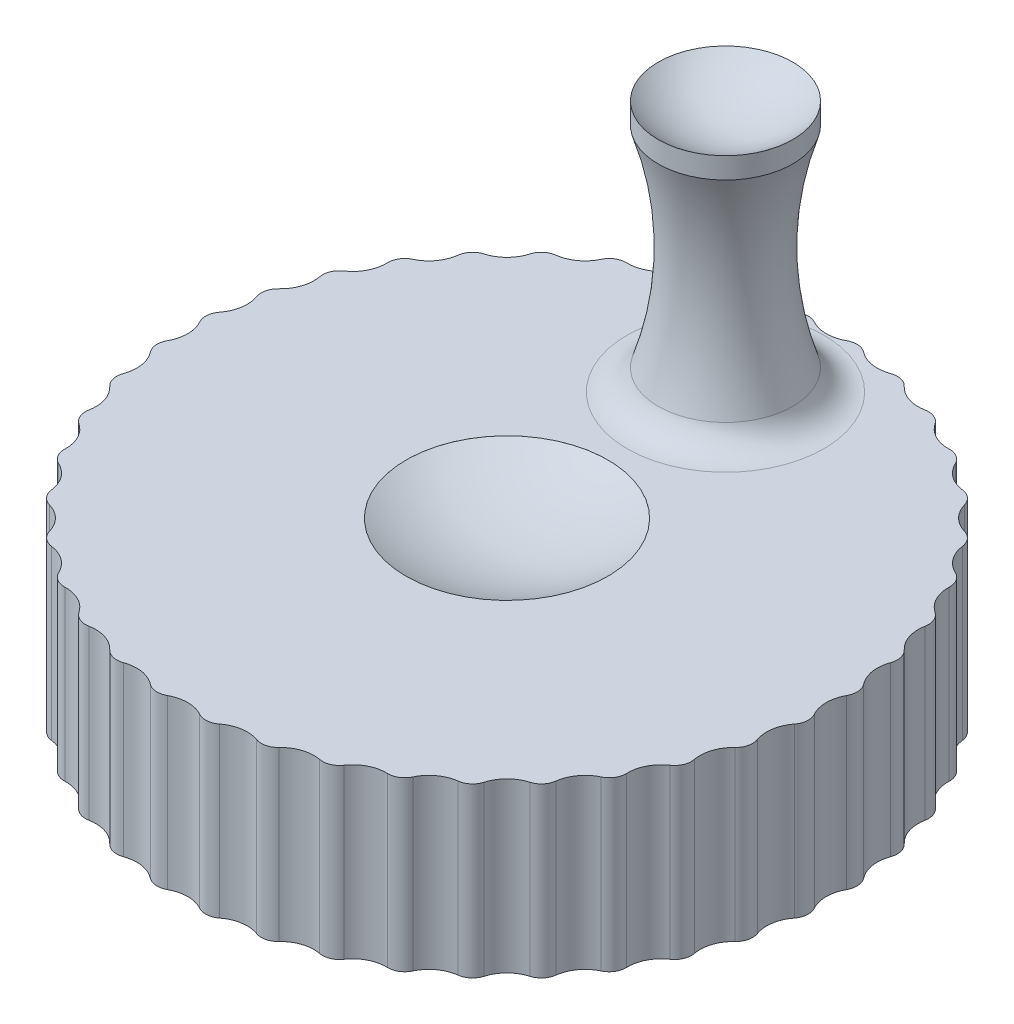
from build123d import *

# Parameters (mm, degrees)
SKETCH1_R               = 20
BOSS_EXTRUDE1_DEPTH     = 10
CUT_EXTRUDE1_DEPTH      = 31
CUT_EXTRUDE1_DEPTH_BACK = 31
FILLET2_R               = 1
SKETCH4_R               = 6
CUT_EXTRUDE3_DEPTH      = 0.001
DOME2_FACE_RADIUS       = 6
DOME2_HEIGHT            = 1.5
SKETCH5_R               = 4
BOSS_EXTRUDE2_DEPTH     = 15
FILLET3_R               = 2
DOME3_FACE_RADIUS       = 4
DOME3_HEIGHT            = 1.5
SKETCH9_R               = 2.75
CUT_EXTRUDE4_DEPTH      = 7.5
CHAMFER1_SIZE           = 2
CHAMFER1_SIZE2          = 0.727940469


with BuildPart() as part:
    # Sketch1 → Boss-Extrude1 (new body)
    with BuildSketch(Plane(origin=(0, 0, 0), x_dir=(1, 0, 0), z_dir=(0, 1, 0))):
        with Locations(Location((0, 0, 0), (0, 0, 270))):
            Circle(SKETCH1_R)
    extrude(amount=BOSS_EXTRUDE1_DEPTH)

    # Sketch2 → Cut-Extrude1 (cut, two sides: drawn at the far end of the back side and taken through both)
    with BuildSketch(Plane(origin=(0, 10, 0), x_dir=(1, 0, 0), z_dir=(0, 1, 0)).offset(-CUT_EXTRUDE1_DEPTH_BACK)):
        with BuildLine():
            ThreePointArc((11.531002805, -18.816886382), (13.519060803, -18.607390871), (14.332646581, -16.781373031))
            ThreePointArc((14.332646581, -16.781373031), (16.263455967, -16.263455967), (16.781373031, -14.332646581))
            ThreePointArc((16.781373031, -14.332646581), (18.607390871, -13.519060803), (18.816886382, -11.531002805))
            ThreePointArc((18.816886382, -11.531002805), (20.493150056, -10.441781494), (20.389065541, -8.445427471))
            ThreePointArc((20.389065541, -8.445427471), (21.874299875, -7.107390871), (21.459198239, -5.151897684))
            ThreePointArc((21.459198239, -5.151897684), (22.716831834, -3.597992696), (22.000934257, -1.731511078))
            ThreePointArc((22.000934257, -1.731511078), (23, 0), (22.000934257, 1.731511078))
            ThreePointArc((22.000934257, 1.731511078), (22.716831834, 3.597992696), (21.459198239, 5.151897684))
            ThreePointArc((21.459198239, 5.151897684), (21.874299875, 7.107390871), (20.389065541, 8.445427471))
            ThreePointArc((20.389065541, 8.445427471), (20.493150056, 10.441781494), (18.816886382, 11.531002805))
            ThreePointArc((18.816886382, 11.531002805), (18.607390871, 13.519060803), (16.781373031, 14.332646581))
            ThreePointArc((16.781373031, 14.332646581), (16.263455967, 16.263455967), (14.332646581, 16.781373031))
            ThreePointArc((14.332646581, 16.781373031), (13.519060803, 18.607390871), (11.531002805, 18.816886382))
            ThreePointArc((11.531002805, 18.816886382), (10.441781494, 20.493150056), (8.445427471, 20.389065541))
            ThreePointArc((8.445427471, 20.389065541), (7.107390871, 21.874299875), (5.151897684, 21.459198239))
            ThreePointArc((5.151897684, 21.459198239), (3.597992696, 22.716831834), (1.731511078, 22.000934257))
            ThreePointArc((1.731511078, 22.000934257), (0, 23), (-1.731511078, 22.000934257))
            ThreePointArc((-1.731511078, 22.000934257), (-3.597992696, 22.716831834), (-5.151897684, 21.459198239))
            ThreePointArc((-5.151897684, 21.459198239), (-7.107390871, 21.874299875), (-8.445427471, 20.389065541))
            ThreePointArc((-8.445427471, 20.389065541), (-10.441781494, 20.493150056), (-11.531002805, 18.816886382))
            ThreePointArc((-11.531002805, 18.816886382), (-13.519060803, 18.607390871), (-14.332646581, 16.781373031))
            ThreePointArc((-14.332646581, 16.781373031), (-16.263455967, 16.263455967), (-16.781373031, 14.332646581))
            ThreePointArc((-16.781373031, 14.332646581), (-18.607390871, 13.519060803), (-18.816886382, 11.531002805))
            ThreePointArc((-18.816886382, 11.531002805), (-20.493150056, 10.441781494), (-20.389065541, 8.445427471))
            ThreePointArc((-20.389065541, 8.445427471), (-21.874299875, 7.107390871), (-21.459198239, 5.151897684))
            ThreePointArc((-21.459198239, 5.151897684), (-22.716831834, 3.597992696), (-22.000934257, 1.731511078))
            ThreePointArc((-22.000934257, 1.731511078), (-23, 0), (-22.000934257, -1.731511078))
            ThreePointArc((-22.000934257, -1.731511078), (-22.716831834, -3.597992696), (-21.459198239, -5.151897684))
            ThreePointArc((-21.459198239, -5.151897684), (-21.874299875, -7.107390871), (-20.389065541, -8.445427471))
            ThreePointArc((-20.389065541, -8.445427471), (-20.493150056, -10.441781494), (-18.816886382, -11.531002805))
            ThreePointArc((-18.816886382, -11.531002805), (-18.607390871, -13.519060803), (-16.781373031, -14.332646581))
            ThreePointArc((-16.781373031, -14.332646581), (-16.263455967, -16.263455967), (-14.332646581, -16.781373031))
            ThreePointArc((-14.332646581, -16.781373031), (-13.519060803, -18.607390871), (-11.531002805, -18.816886382))
            ThreePointArc((-11.531002805, -18.816886382), (-10.441781494, -20.493150056), (-8.445427471, -20.389065541))
            ThreePointArc((-8.445427471, -20.389065541), (-7.107390871, -21.874299875), (-5.151897684, -21.459198239))
            ThreePointArc((-5.151897684, -21.459198239), (-3.597992696, -22.716831834), (-1.731511078, -22.000934257))
            ThreePointArc((-1.731511078, -22.000934257), (0, -23), (1.731511078, -22.000934257))
            ThreePointArc((1.731511078, -22.000934257), (3.597992696, -22.716831834), (5.151897684, -21.459198239))
            ThreePointArc((5.151897684, -21.459198239), (7.107390871, -21.874299875), (8.445427471, -20.389065541))
            ThreePointArc((8.445427471, -20.389065541), (10.441781494, -20.493150056), (11.531002805, -18.816886382))
        make_face()
        with BuildLine():
            ThreePointArc((-1.553612688, 19.740520895), (0, 19), (1.553612688, 19.740520895))
            ThreePointArc((1.553612688, 19.740520895), (2.972254836, 18.766078471), (4.622582964, 19.254443756))
            ThreePointArc((4.622582964, 19.254443756), (5.871322893, 18.07007381), (7.577729905, 18.294258309))
            ThreePointArc((7.577729905, 18.294258309), (8.625819495, 16.92912396), (10.346287987, 16.883607508))
            ThreePointArc((10.346287987, 16.883607508), (11.167919794, 15.371322893), (12.860086122, 15.057226256))
            ThreePointArc((12.860086122, 15.057226256), (13.435028843, 13.435028843), (15.057226256, 12.860086122))
            ThreePointArc((15.057226256, 12.860086122), (15.371322893, 11.167919794), (16.883607508, 10.346287987))
            ThreePointArc((16.883607508, 10.346287987), (16.92912396, 8.625819495), (18.294258309, 7.577729905))
            ThreePointArc((18.294258309, 7.577729905), (18.07007381, 5.871322893), (19.254443756, 4.622582964))
            ThreePointArc((19.254443756, 4.622582964), (18.766078471, 2.972254836), (19.740520895, 1.553612688))
            ThreePointArc((19.740520895, 1.553612688), (19, 0), (19.740520895, -1.553612688))
            ThreePointArc((19.740520895, -1.553612688), (18.766078471, -2.972254836), (19.254443756, -4.622582964))
            ThreePointArc((19.254443756, -4.622582964), (18.07007381, -5.871322893), (18.294258309, -7.577729905))
            ThreePointArc((18.294258309, -7.577729905), (16.92912396, -8.625819495), (16.883607508, -10.346287987))
            ThreePointArc((16.883607508, -10.346287987), (15.371322893, -11.167919794), (15.057226256, -12.860086122))
            ThreePointArc((15.057226256, -12.860086122), (13.435028843, -13.435028843), (12.860086122, -15.057226256))
            ThreePointArc((12.860086122, -15.057226256), (11.167919794, -15.371322893), (10.346287987, -16.883607508))
            ThreePointArc((10.346287987, -16.883607508), (8.625819495, -16.92912396), (7.577729905, -18.294258309))
            ThreePointArc((7.577729905, -18.294258309), (5.871322893, -18.07007381), (4.622582964, -19.254443756))
            ThreePointArc((4.622582964, -19.254443756), (2.972254836, -18.766078471), (1.553612688, -19.740520895))
            ThreePointArc((1.553612688, -19.740520895), (0, -19), (-1.553612688, -19.740520895))
            ThreePointArc((-1.553612688, -19.740520895), (-2.972254836, -18.766078471), (-4.622582964, -19.254443756))
            ThreePointArc((-4.622582964, -19.254443756), (-5.871322893, -18.07007381), (-7.577729905, -18.294258309))
            ThreePointArc((-7.577729905, -18.294258309), (-8.625819495, -16.92912396), (-10.346287987, -16.883607508))
            ThreePointArc((-10.346287987, -16.883607508), (-11.167919794, -15.371322893), (-12.860086122, -15.057226256))
            ThreePointArc((-12.860086122, -15.057226256), (-13.435028843, -13.435028843), (-15.057226256, -12.860086122))
            ThreePointArc((-15.057226256, -12.860086122), (-15.371322893, -11.167919794), (-16.883607508, -10.346287987))
            ThreePointArc((-16.883607508, -10.346287987), (-16.92912396, -8.625819495), (-18.294258309, -7.577729905))
            ThreePointArc((-18.294258309, -7.577729905), (-18.07007381, -5.871322893), (-19.254443756, -4.622582964))
            ThreePointArc((-19.254443756, -4.622582964), (-18.766078471, -2.972254836), (-19.740520895, -1.553612688))
            ThreePointArc((-19.740520895, -1.553612688), (-19, 0), (-19.740520895, 1.553612688))
            ThreePointArc((-19.740520895, 1.553612688), (-18.766078471, 2.972254836), (-19.254443756, 4.622582964))
            ThreePointArc((-19.254443756, 4.622582964), (-18.07007381, 5.871322893), (-18.294258309, 7.577729905))
            ThreePointArc((-18.294258309, 7.577729905), (-16.92912396, 8.625819495), (-16.883607508, 10.346287987))
            ThreePointArc((-16.883607508, 10.346287987), (-15.371322893, 11.167919794), (-15.057226256, 12.860086122))
            ThreePointArc((-15.057226256, 12.860086122), (-13.435028843, 13.435028843), (-12.860086122, 15.057226256))
            ThreePointArc((-12.860086122, 15.057226256), (-11.167919794, 15.371322893), (-10.346287987, 16.883607508))
            ThreePointArc((-10.346287987, 16.883607508), (-8.625819495, 16.92912396), (-7.577729905, 18.294258309))
            ThreePointArc((-7.577729905, 18.294258309), (-5.871322893, 18.07007381), (-4.622582964, 19.254443756))
            ThreePointArc((-4.622582964, 19.254443756), (-2.972254836, 18.766078471), (-1.553612688, 19.740520895))
        make_face(mode=Mode.SUBTRACT)
    extrude(amount=CUT_EXTRUDE1_DEPTH + CUT_EXTRUDE1_DEPTH_BACK, mode=Mode.SUBTRACT)

    # Fillet2
    fillet2_edges = [part.edges().sort_by_distance(p)[0] for p in [
        (12.860086122, 5, -15.057226256),
        (10.346287987, 5, -16.883607508),
        (7.577729905, 5, -18.294258309),
        (4.622582964, 5, -19.254443756),
        (1.553612688, 5, -19.740520895),
        (-1.553612688, 5, -19.740520895),
        (-4.622582964, 5, -19.254443756),
        (-7.577729905, 5, -18.294258309),
        (-10.346287987, 5, -16.883607508),
        (-12.860086122, 5, -15.057226256),
        (-15.057226256, 5, -12.860086122),
        (-16.883607508, 5, -10.346287987),
        (-18.294258309, 5, -7.577729905),
        (-19.254443756, 5, -4.622582964),
        (-19.740520895, 5, -1.553612688),
        (-19.740520895, 5, 1.553612688),
        (-19.254443756, 5, 4.622582964),
        (-18.294258309, 5, 7.577729905),
        (-16.883607508, 5, 10.346287987),
        (-15.057226256, 5, 12.860086122),
        (-12.860086122, 5, 15.057226256),
        (-10.346287987, 5, 16.883607508),
        (-7.577729905, 5, 18.294258309),
        (-1.553612688, 5, 19.740520895),
        (-4.622582964, 5, 19.254443756),
        (1.553612688, 5, 19.740520895),
        (4.622582964, 5, 19.254443756),
        (7.577729905, 5, 18.294258309),
        (10.346287987, 5, 16.883607508),
        (12.860086122, 5, 15.057226256),
        (15.057226256, 5, 12.860086122),
        (16.883607508, 5, 10.346287987),
        (18.294258309, 5, 7.577729905),
        (19.254443756, 5, 4.622582964),
        (19.740520895, 5, 1.553612688),
        (19.740520895, 5, -1.553612688),
        (19.254443756, 5, -4.622582964),
        (18.294258309, 5, -7.577729905),
        (16.883607508, 5, -10.346287987),
        (15.057226256, 5, -12.860086122),
    ]]
    fillet(fillet2_edges, radius=FILLET2_R)

    # Sketch4 → Cut-Extrude3 (cut)
    with BuildSketch(Plane(origin=(0, 10, 0), x_dir=(1, 0, 0), z_dir=(0, 1, 0))):
        with Locations(Location((0, 0, 0), (0, 0, 270))):
            Circle(SKETCH4_R)
    extrude(amount=-CUT_EXTRUDE3_DEPTH, mode=Mode.SUBTRACT)

    # Dome2: a dome of height H over a round flat face of radius A is a cap of a sphere of radius (A * A + H * H) / (2 * H)
    dome2_r = (DOME2_FACE_RADIUS * DOME2_FACE_RADIUS + DOME2_HEIGHT * DOME2_HEIGHT) / (2 * DOME2_HEIGHT)
    dome2_base = Plane((0, 9.999, 0), z_dir=(0, -1, 0))
    with Locations(dome2_base.offset(DOME2_HEIGHT - dome2_r)):
        dome2_ball = Sphere(dome2_r, mode=Mode.PRIVATE)
    add(split(dome2_ball, bisect_by=dome2_base, keep=Keep.TOP, mode=Mode.PRIVATE), mode=Mode.SUBTRACT)

    # Sketch5 → Boss-Extrude2 (add)
    with BuildSketch(Plane(origin=(0, 10, 0), x_dir=(1, 0, 0), z_dir=(0, 1, 0))):
        with Locations(Location((0, 13, 0), (0, 0, 270))):
            Circle(SKETCH5_R)
    extrude(amount=BOSS_EXTRUDE2_DEPTH)

    # Sketch7 → Cut-Revolve1 (revolve, cut)
    with BuildSketch(Plane.XY.offset(-13)):
        with BuildLine():
            Line((-4, 23.744997998), (-4, 11.255002002))
            ThreePointArc((-4, 11.255002002), (-3, 17.5), (-4, 23.744997998))
        make_face()
    revolve(axis=Axis((0, 25, -13), (0, -1, 0)), mode=Mode.SUBTRACT)

    # Fillet3
    # the kernel refuses this fillet: 2 mm, written as the material it adds along each edge
    with BuildSketch(Plane(origin=(0, 10, -13), x_dir=(0, 0, 1), z_dir=(-1, 0, 0))) as fillet3_piece_1:
        with BuildLine():
            CenterArc((5.856065188, 2), FILLET3_R, 201.869819824, 68.130180176)
            Line((4, 1.255002002), (3.962878696, 1.240102042))
            ThreePointArc((3.962878696, 1.240102042), (3.96, 0.627501001), (3.96, 0))
            Line((3.96, 0), (4, -0.04))
            Line((4, -0.04), (5.856065188, -0.04))
            Line((5.856065188, -0.04), (5.856065188, 0))
        make_face()
    revolve(axis=Axis((0, 10, -13), (0, 1, 0)))

    # Dome3: a dome of height H over a round flat face of radius A is a cap of a sphere of radius (A * A + H * H) / (2 * H)
    dome3_r = (DOME3_FACE_RADIUS * DOME3_FACE_RADIUS + DOME3_HEIGHT * DOME3_HEIGHT) / (2 * DOME3_HEIGHT)
    dome3_base = Plane((0, 25, -13), z_dir=(0, -1, 0))
    with Locations(dome3_base.offset(DOME3_HEIGHT - dome3_r)):
        dome3_ball = Sphere(dome3_r, mode=Mode.PRIVATE)
    add(split(dome3_ball, bisect_by=dome3_base, keep=Keep.TOP, mode=Mode.PRIVATE), mode=Mode.SUBTRACT)

    # Sketch9 → Cut-Extrude4 (cut)
    with BuildSketch(Plane.XZ):
        with Locations(Location((0, 0, 0), (0, 0, 270))):
            Circle(SKETCH9_R)
    extrude(amount=-CUT_EXTRUDE4_DEPTH, mode=Mode.SUBTRACT)

    # Chamfer1
    chamfer1_edges = [part.edges().sort_by_distance(p)[0] for p in [
        (0, 0, 2.75),
    ]]
    chamfer1_side = [part.faces().sort_by_distance(p)[0] for p in [
        (-5.70201056, 0, -17.548984028),
    ]]
    chamfer(chamfer1_edges, length=CHAMFER1_SIZE, length2=CHAMFER1_SIZE2, reference=chamfer1_side[0])


solid = part.part
